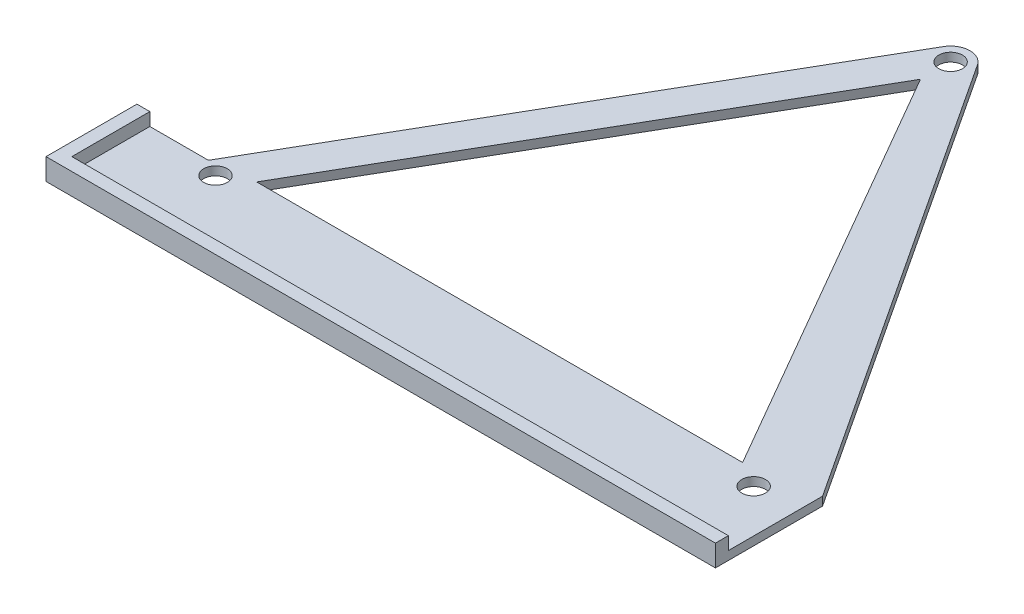
from build123d import *

# Parameters (mm, degrees)
SKETCH1_R           = 2.75
BOSS_EXTRUDE4_DEPTH = 2
BOSS_EXTRUDE7_DEPTH = 5


with BuildPart() as part:
    # Sketch1 → Boss-Extrude4 (new body)
    with BuildSketch(Plane(origin=(0, 0, 0), x_dir=(1, 0, 0), z_dir=(0, 1, 0))):
        with BuildLine():
            ThreePointArc((3.897114317, 56.376587737), (0, 58.626587737), (-3.897114317, 56.376587737))
            Line((-3.897114317, 56.376587737), (-66.397114317, -51.876587737))
            Line((-66.397114317, -51.876587737), (-80, -51.876587737))
            Line((-80, -51.876587737), (-80, -70))
            Line((-80, -70), (72.5, -70))
            Line((72.5, -70), (72.5, -48.115728134))
            Line((72.5, -48.115728134), (3.897114317, 56.376587737))
        make_face()
        with Locations((-62.5, -54.126587737)):
            Circle(SKETCH1_R, mode=Mode.SUBTRACT)
        with Locations((62.5, -54.126587737)):
            Circle(SKETCH1_R, mode=Mode.SUBTRACT)
        Polygon((56.437822174, -50.626587737), (-56.437822174, -50.626587737), (0, 47.126587737), align=None, mode=Mode.SUBTRACT)
        with Locations((0, 54.126587737)):
            Circle(SKETCH1_R, mode=Mode.SUBTRACT)
    extrude(amount=BOSS_EXTRUDE4_DEPTH)

    # Sketch1<6> → Boss-Extrude7 (add)
    with BuildSketch(Plane(origin=(0, 0, 0), x_dir=(1, 0, 0), z_dir=(0, 1, 0))):
        Polygon((-80, -70), (-80, -51.876587737), (-83, -51.876587737), (-83, -73), (72.5, -73), (72.5, -70), align=None)
    extrude(amount=BOSS_EXTRUDE7_DEPTH)


solid = part.part
